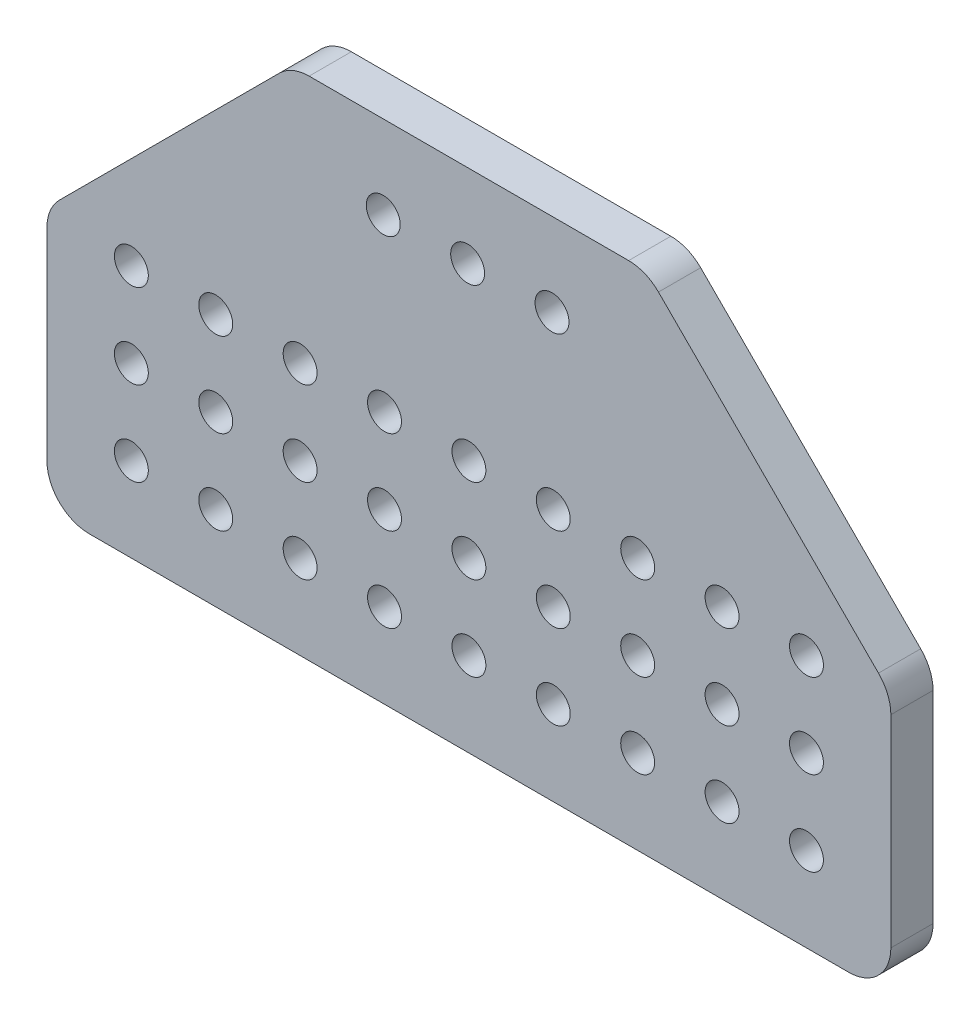
from build123d import *

# Parameters (mm, degrees)
SKETCH1_W               = 127
SKETCH1_H               = 82.55
BOSS_EXTRUDE1_DEPTH     = 6.35
CUT_EXTRUDE1_DEPTH      = 152.604172106
CUT_EXTRUDE1_DEPTH_BACK = 152.604172106
SKETCH2_R               = 2.5527
SKETCH3_R               = 2.5527
CUT_EXTRUDE2_DEPTH      = 152.604172106
CUT_EXTRUDE3_DEPTH      = 152.604172106
CUT_EXTRUDE4_DEPTH      = 152.604172106
FILLET1_R               = 6.35


with BuildPart() as part:
    # Sketch1 → Boss-Extrude1 (new body)
    with BuildSketch(Plane.XY):
        with Locations((63.5, 41.275)):
            Rectangle(SKETCH1_W, SKETCH1_H)
    extrude(amount=BOSS_EXTRUDE1_DEPTH)

    # Sketch2 → Cut-Extrude1 (cut, two sides: drawn at the far end of the back side and taken through both)
    with BuildSketch(Plane(origin=(0, 0, 0), x_dir=(-1, 0, 0), z_dir=(0, 0, -1)).offset(-CUT_EXTRUDE1_DEPTH_BACK)):
        with Locations((-76.0095, 63.6905)):
            Circle(SKETCH2_R)
        with Locations((-63.3095, 63.6905)):
            Circle(SKETCH2_R)
        with Locations((-50.6095, 63.6905)):
            Circle(SKETCH2_R)
    extrude(amount=CUT_EXTRUDE1_DEPTH + CUT_EXTRUDE1_DEPTH_BACK, mode=Mode.SUBTRACT)

    # Sketch3 → Cut-Extrude2 (cut, through all)
    with BuildSketch(Plane(origin=(0, 0, 0), x_dir=(-1, 0, 0), z_dir=(0, 0, -1))):
        with Locations((-114.3, 38.1)):
            Circle(SKETCH3_R)
        with Locations((-114.3, 25.4)):
            Circle(SKETCH3_R)
        with Locations((-114.3, 12.7)):
            Circle(SKETCH3_R)
        with Locations((-101.6, 38.1)):
            Circle(SKETCH3_R)
        with Locations((-101.6, 25.4)):
            Circle(SKETCH3_R)
        with Locations((-101.6, 12.7)):
            Circle(SKETCH3_R)
        with Locations((-88.9, 38.1)):
            Circle(SKETCH3_R)
        with Locations((-88.9, 25.4)):
            Circle(SKETCH3_R)
        with Locations((-88.9, 12.7)):
            Circle(SKETCH3_R)
        with Locations((-76.2, 38.1)):
            Circle(SKETCH3_R)
        with Locations((-76.2, 25.4)):
            Circle(SKETCH3_R)
        with Locations((-76.2, 12.7)):
            Circle(SKETCH3_R)
        with Locations((-63.5, 38.1)):
            Circle(SKETCH3_R)
        with Locations((-63.5, 25.4)):
            Circle(SKETCH3_R)
        with Locations((-63.5, 12.7)):
            Circle(SKETCH3_R)
        with Locations((-50.8, 38.1)):
            Circle(SKETCH3_R)
        with Locations((-50.8, 25.4)):
            Circle(SKETCH3_R)
        with Locations((-50.8, 12.7)):
            Circle(SKETCH3_R)
        with Locations((-38.1, 38.1)):
            Circle(SKETCH3_R)
        with Locations((-38.1, 25.4)):
            Circle(SKETCH3_R)
        with Locations((-38.1, 12.7)):
            Circle(SKETCH3_R)
        with Locations((-25.4, 38.1)):
            Circle(SKETCH3_R)
        with Locations((-25.4, 25.4)):
            Circle(SKETCH3_R)
        with Locations((-25.4, 12.7)):
            Circle(SKETCH3_R)
        with Locations((-12.7, 38.1)):
            Circle(SKETCH3_R)
        with Locations((-12.7, 25.4)):
            Circle(SKETCH3_R)
        with Locations((-12.7, 12.7)):
            Circle(SKETCH3_R)
    extrude(amount=-CUT_EXTRUDE2_DEPTH, mode=Mode.SUBTRACT)

    # Sketch4 → Cut-Extrude3 (cut, through all)
    with BuildSketch(Plane(origin=(0, 0, 0), x_dir=(-1, 0, 0), z_dir=(0, 0, -1))):
        Polygon((-83.82, 82.55), (-127, 39.37), (-127, 82.55), align=None)
        Polygon((-43.18, 82.55), (0, 82.55), (0, 39.37), align=None)
    extrude(amount=-CUT_EXTRUDE3_DEPTH, mode=Mode.SUBTRACT)

    # Sketch5 → Cut-Extrude4 (cut, through all)
    with BuildSketch(Plane(origin=(0, 0, 0), x_dir=(-1, 0, 0), z_dir=(0, 0, -1))):
        Polygon((-90.17, 76.2), (-36.83, 76.2), (-43.18, 82.55), (-83.82, 82.55), align=None)
    extrude(amount=-CUT_EXTRUDE4_DEPTH, mode=Mode.SUBTRACT)

    # Fillet1
    fillet1_edges = [part.edges().sort_by_distance(p)[0] for p in [
        (127, 39.37, 3.175),
        (127, 0, 3.175),
        (0, 0, 3.175),
        (36.83, 76.2, 3.175),
        (90.17, 76.2, 3.175),
        (0, 39.37, 3.175),
    ]]
    fillet(fillet1_edges, radius=FILLET1_R)


solid = part.part
